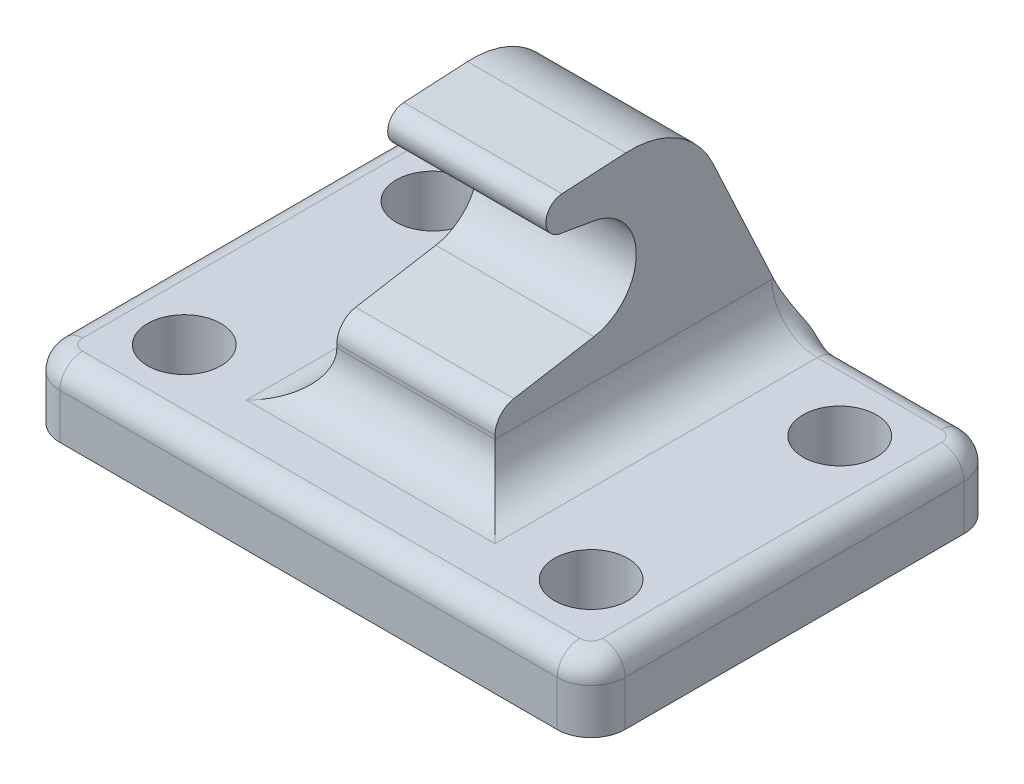
from build123d import *

# Parameters (mm, degrees)
SKETCH1_W           = 79.375
SKETCH1_H           = 57.14999999999999
BASE_EXTRUDE_DEPTH  = 9.525
SKETCH2_R           = 5.1562
CUT_EXTRUDE1_DEPTH  = 99.27125088244273
BOSS_EXTRUDE1_DEPTH = 11.112499999999999
FILLET1_R           = 4.7625
FILLET3_R           = 3.175
FILLET5_R           = 6.35
FILLET6_R           = 3.175


with BuildPart() as part:
    # Sketch1 → Base-Extrude (new body)
    with BuildSketch(Plane(origin=(0, 0, 0), x_dir=(1, 0, 0), z_dir=(0, 1, 0))):
        with Locations((39.6875, 28.574999999999996)):
            Rectangle(SKETCH1_W, SKETCH1_H)
    extrude(amount=BASE_EXTRUDE_DEPTH)

    # Sketch2 → Cut-Extrude1 (cut, through all)
    with BuildSketch(Plane(origin=(0, 9.525, 0), x_dir=(-1, 0, 0), z_dir=(0, 1, 0))):
        with Locations(Location((-11.112499999999999, -46.037499999999994, 0), (0, 0, 90))):
            Circle(SKETCH2_R)
        with Locations(Location((-11.112499999999999, -11.112499999999997, 0), (0, 0, 90))):
            Circle(SKETCH2_R)
        with Locations(Location((-68.2625, -11.112499999999997, 0), (0, 0, 90))):
            Circle(SKETCH2_R)
        with Locations(Location((-68.2625, -46.037499999999994, 0), (0, 0, 90))):
            Circle(SKETCH2_R)
    extrude(amount=-CUT_EXTRUDE1_DEPTH, mode=Mode.SUBTRACT)

    # Sketch3 → Boss-Extrude1 (add, symmetric)
    with BuildSketch(Plane(origin=(39.6875, 0, 0), x_dir=(0, 0, -1), z_dir=(1, 0, 0))):
        with BuildLine():
            Line((15.081249999999999, 9.525), (57.15, 9.525))
            Line((57.15, 9.525), (45.642080901347875, 34.2124833053063))
            ThreePointArc((45.642080901347875, 34.2124833053063), (40.65983135726152, 39.74024710013013), (33.435990911126424, 41.52773480629668))
            Line((33.435990911126424, 41.52773480629668), (24.475888920836205, 41.03647902618064))
            ThreePointArc((24.475888920836205, 41.03647902618064), (22.228971581677126, 38.79627321294108), (24.202681662531663, 36.31199703436931))
            Line((24.202681662531663, 36.31199703436931), (28.991955012405008, 35.48840889689211))
            ThreePointArc((28.991955012405008, 35.48840889689211), (34.924994788062534, 28.439370658797703), (28.97494247235726, 21.40468669276046))
            Line((28.97494247235726, 21.40468669276046), (17.72572001228568, 19.498181673786302))
            ThreePointArc((17.72572001228568, 19.498181673786302), (15.830857484241669, 18.416745811263993), (15.081249999999997, 16.367820203902035))
            Line((15.081249999999997, 16.367820203902035), (15.081249999999999, 9.525))
        make_face()
    extrude(amount=BOSS_EXTRUDE1_DEPTH, both=True)

    # Fillet1
    fillet1_edges = [part.edges().sort_by_distance(p)[0] for p in [
        (0, 4.7625, -57.15),
        (79.375, 4.7625, -57.15),
        (79.375, 4.7625, 0),
        (0, 4.7625, 0),
    ]]
    fillet(fillet1_edges, radius=FILLET1_R)

    # Fillet3
    fillet3_edges = [part.edges().sort_by_distance(p)[0] for p in [
        (16.668750000000003, 9.525, -57.15),
        (39.6875, 9.525, 0),
        (0, 9.525, -28.575),
        (79.375, 9.525, -28.575),
        (62.70625, 9.525, -57.15),
        (77.98009604540093, 9.525, -55.75509604540093),
        (1.3949039545990662, 9.525, -55.75509604540093),
        (77.98009604540093, 9.525, -1.3949039545990662),
        (1.3949039545990667, 9.525, -1.3949039545990662),
    ]]
    fillet(fillet3_edges, radius=FILLET3_R)

    # Fillet5
    # the kernel refuses this fillet: 6.35 mm, written as the material it adds along each edge
    with BuildSketch(Plane(origin=(28.575000000000003, 9.525, -15.081249999999997), x_dir=(-1, 0, 0), z_dir=(0, 0, -1))) as fillet5_piece_1:
        with BuildLine():
            CenterArc((FILLET5_R, FILLET5_R), FILLET5_R, 180, 90)
            Line((0, FILLET5_R), (0, 0))
            Line((0, 0), (FILLET5_R, 0))
        make_face()
    extrude(amount=38.893750000000004)
    with BuildSketch(Plane(origin=(50.8, 9.525, -15.081249999999999), x_dir=(0, 0, 1), z_dir=(-1, 0, 0))) as fillet5_piece_2:
        with BuildLine():
            CenterArc((FILLET5_R, FILLET5_R), FILLET5_R, 180, 90)
            Line((3.55e-15, FILLET5_R), (0, 0))
            Line((0, 0), (FILLET5_R, 0))
        make_face()
    extrude(amount=22.224999999999994)
    with BuildSketch(Plane(origin=(50.8, 9.525, -15.081249999999997), x_dir=(1, 0, 0), z_dir=(0, 0, -1))) as fillet5_piece_3:
        with BuildLine():
            CenterArc((FILLET5_R, -FILLET5_R), FILLET5_R, 90, 90)
            Line((0, -FILLET5_R), (0, 0))
            Line((0, 0), (FILLET5_R, 0))
        make_face()
    extrude(amount=38.893750000000004)
    with BuildSketch(Plane(origin=(28.575000000000003, 6.350000000000001, -53.975), x_dir=(0, 1, 0), z_dir=(0, 0, 1))) as fillet5_piece_4_section:
        with BuildLine():
            CenterArc((3.174999999999999 + FILLET5_R, FILLET5_R), FILLET5_R, 180.00000000000003, 90)
            Line((3.174999999999999, FILLET5_R), (3.174999999999999, 0))
            Line((3.174999999999999, 0), (3.174999999999999 + FILLET5_R, 0))
        make_face()
    fillet5_piece_4 = revolve(axis=Axis((28.575000000000003, 6.350000000000001, -53.975), (-1, 0, 0)), revolution_arc=359.64000000000004, mode=Mode.PRIVATE)
    fillet5_piece_4 = split(fillet5_piece_4, bisect_by=Plane(origin=(28.575000000000003, 0, -53.975), z_dir=(0, 1, 0)), keep=Keep.TOP, mode=Mode.PRIVATE)
    fillet5_piece_4 = split(fillet5_piece_4, bisect_by=Plane(origin=(28.575000000000003, 6.350000000000001, -57.15), z_dir=(0, 0, 1)), keep=Keep.TOP, mode=Mode.PRIVATE)
    fillet5_piece_4 = split(fillet5_piece_4, bisect_by=Plane(origin=(28.575000000000003, 8.132568412888961, -57.799073453811204), z_dir=(0, -0.42249632325246483, 0.9063646379014071)), keep=Keep.TOP, mode=Mode.PRIVATE)
    add(fillet5_piece_4)
    with BuildSketch(Plane(origin=(50.8, 6.350000000000001, -53.975), x_dir=(0, 1, 0), z_dir=(0, 0, 1))) as fillet5_piece_5_section:
        with BuildLine():
            CenterArc((3.174999999999999 + FILLET5_R, -FILLET5_R), FILLET5_R, 90, 90)
            Line((3.174999999999999, -FILLET5_R), (3.174999999999999, 0))
            Line((3.174999999999999, 0), (3.174999999999999 + FILLET5_R, 0))
        make_face()
    fillet5_piece_5 = revolve(axis=Axis((50.8, 6.350000000000001, -53.975), (-1, 0, 0)), revolution_arc=359.64000000000004, mode=Mode.PRIVATE)
    fillet5_piece_5 = split(fillet5_piece_5, bisect_by=Plane(origin=(50.8, 0, -53.975), z_dir=(0, 1, 0)), keep=Keep.TOP, mode=Mode.PRIVATE)
    fillet5_piece_5 = split(fillet5_piece_5, bisect_by=Plane(origin=(50.8, 6.350000000000001, -57.15), z_dir=(0, 0, 1)), keep=Keep.TOP, mode=Mode.PRIVATE)
    fillet5_piece_5 = split(fillet5_piece_5, bisect_by=Plane(origin=(50.8, 8.132568412888961, -57.799073453811204), z_dir=(0, -0.42249632325246483, 0.9063646379014071)), keep=Keep.TOP, mode=Mode.PRIVATE)
    add(fillet5_piece_5)
    with BuildSketch(Plane(origin=(28.575000000000003, 9.525, 0.7937500000000028), x_dir=(-1, 0, 0), z_dir=(0, 0, -1))) as fillet5_piece_6a_section:
        with BuildLine():
            CenterArc((FILLET5_R, FILLET5_R), FILLET5_R, 180, 90)
            Line((0, FILLET5_R), (0, 0))
            Line((0, 0), (FILLET5_R, 0))
        make_face()
    fillet5_piece_6a = extrude(amount=54.768750000000004, mode=Mode.PRIVATE)
    fillet5_piece_6a = split(fillet5_piece_6a, bisect_by=Plane(origin=(28.575000000000003, 9.525000000000004, -15.081249999999999), z_dir=(0, -2.6e-16, 1)), keep=Keep.TOP, mode=Mode.PRIVATE)
    with BuildSketch(Plane(origin=(50.8, 9.525, -15.081249999999999), x_dir=(0, 0, 1), z_dir=(-1, 0, 0))) as fillet5_piece_6b_section:
        with BuildLine():
            CenterArc((FILLET5_R, FILLET5_R), FILLET5_R, 180, 90)
            Line((3.55e-15, FILLET5_R), (0, 0))
            Line((0, 0), (FILLET5_R, 0))
        make_face()
    fillet5_piece_6b = extrude(amount=38.1, mode=Mode.PRIVATE)
    fillet5_piece_6b = fillet5_piece_6b - Plane(origin=(11.112499999999999, 9.525, -11.112499999999997), x_dir=(-6e-17, 0, 1), z_dir=(0, 1, 0)) * Cylinder(5.1562, 102, mode=Mode.PRIVATE)
    fillet5_piece_6b = split(fillet5_piece_6b, bisect_by=Plane(origin=(28.575000000000003, 9.525, -15.081249999999999), z_dir=(-1, 0, 0)), keep=Keep.TOP, mode=Mode.PRIVATE)
    fillet5_piece_6 = fillet5_piece_6a & fillet5_piece_6b
    add(fillet5_piece_6)
    with BuildSketch(Plane(origin=(66.675, 9.525, -15.081249999999999), x_dir=(0, 0, 1), z_dir=(-1, 0, 0))) as fillet5_piece_7a_section:
        with BuildLine():
            CenterArc((FILLET5_R, FILLET5_R), FILLET5_R, 180, 90)
            Line((3.55e-15, FILLET5_R), (0, 0))
            Line((0, 0), (FILLET5_R, 0))
        make_face()
    fillet5_piece_7a = extrude(amount=38.099999999999994, mode=Mode.PRIVATE)
    fillet5_piece_7a = fillet5_piece_7a - Plane(origin=(68.2625, 9.525, -11.112499999999997), x_dir=(-6e-17, 0, 1), z_dir=(0, 1, 0)) * Cylinder(5.1562, 102, mode=Mode.PRIVATE)
    fillet5_piece_7a = split(fillet5_piece_7a, bisect_by=Plane(origin=(50.8, 9.525, -15.081249999999999), z_dir=(1, 0, 0)), keep=Keep.TOP, mode=Mode.PRIVATE)
    with BuildSketch(Plane(origin=(50.8, 9.525, 0.7937500000000028), x_dir=(1, 0, 0), z_dir=(0, 0, -1))) as fillet5_piece_7b_section:
        with BuildLine():
            CenterArc((FILLET5_R, -FILLET5_R), FILLET5_R, 90, 90)
            Line((0, -FILLET5_R), (0, 0))
            Line((0, 0), (FILLET5_R, 0))
        make_face()
    fillet5_piece_7b = extrude(amount=54.768750000000004, mode=Mode.PRIVATE)
    fillet5_piece_7b = split(fillet5_piece_7b, bisect_by=Plane(origin=(50.8, 9.525000000000004, -15.081249999999999), z_dir=(0, -2.6e-16, 1)), keep=Keep.TOP, mode=Mode.PRIVATE)
    fillet5_piece_7 = fillet5_piece_7a & fillet5_piece_7b
    add(fillet5_piece_7)

    # Fillet6
    fillet6_edges = [part.edges().sort_by_distance(p)[0] for p in [
        (39.6875, 9.525000000000507, -57.150000000000006),
    ]]
    fillet(fillet6_edges, radius=FILLET6_R)


solid = part.part
